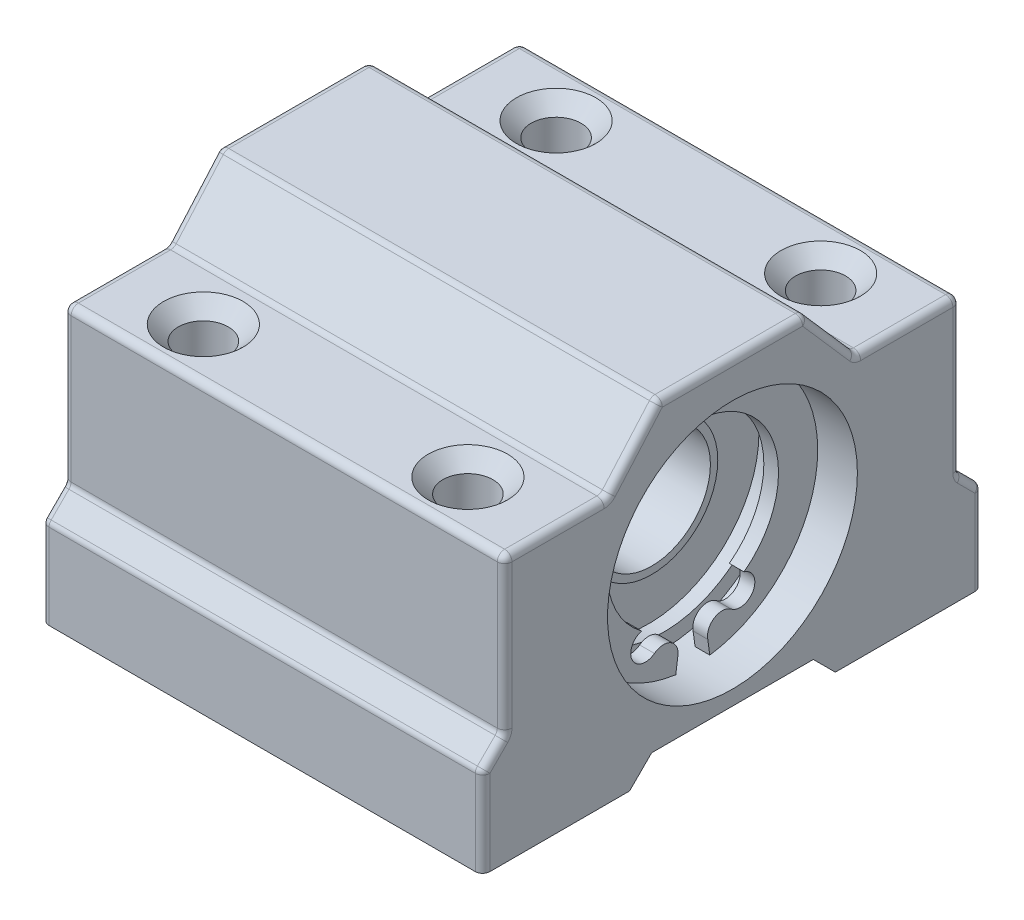
from build123d import *

# Parameters (mm, degrees)
SKETCH1_R           = 8.5
BOSS_EXTRUDE1_DEPTH = 30
EXTRUDE_THIN1_START = 0.5
SKETCH1_4_R         = 4.5
SKETCH1_4_R_2       = 4
EXTRUDE_THIN1_DEPTH = 24
BOSS_EXTRUDE2_START = 0.8
SKETCH1_5_R         = 7.5
SKETCH1_5_R_2       = 4
BOSS_EXTRUDE2_DEPTH = 23.5
BOSS_EXTRUDE3_START = 0.3
SKETCH1_6_R         = 8.5
SKETCH1_6_R_2       = 7.5
BOSS_EXTRUDE3_DEPTH = 25
BOSS_EXTRUDE4_START = 1
BOSS_EXTRUDE4_DEPTH = 1
FILLET1_R           = 0.5
SKETCH4_R           = 1.7
CUT_EXTRUDE3_DEPTH  = 41.902322746
CHAMFER1_SIZE       = 1


with BuildPart() as part:
    # Sketch1 → Boss-Extrude1 (new body)
    with BuildSketch(Plane(origin=(0, 0, 0), x_dir=(0, 0, -1), z_dir=(1, 0, 0))):
        Polygon((-17, -11), (-7, -11), (-5.5, -9.5), (5.5, -9.5), (7, -11), (17, -11), (17, -5), (15.5, -3.5), (15.5, 7), (8.5, 7), (5, 11), (-5, 11), (-8.5, 7), (-15.5, 7), (-15.5, -3.5), (-17, -5), align=None)
        Circle(SKETCH1_R, mode=Mode.SUBTRACT)
    extrude(amount=BOSS_EXTRUDE1_DEPTH)



with BuildPart() as body_2:
    # Sketch1<4> → Extrude-Thin1 (new body)
    with BuildSketch(Plane(origin=(0, 0, 0), x_dir=(0, 0, -1), z_dir=(1, 0, 0)).offset(EXTRUDE_THIN1_START)):
        Circle(SKETCH1_4_R)
        Circle(SKETCH1_4_R_2, mode=Mode.SUBTRACT)
    extrude(amount=EXTRUDE_THIN1_DEPTH)

    # Sketch1<5> → Boss-Extrude2 (add)
    with BuildSketch(Plane(origin=(0, 0, 0), x_dir=(0, 0, -1), z_dir=(1, 0, 0)).offset(BOSS_EXTRUDE2_START)):
        Circle(SKETCH1_5_R)
        Circle(SKETCH1_5_R_2, mode=Mode.SUBTRACT)
    extrude(amount=BOSS_EXTRUDE2_DEPTH)


with BuildPart() as part_1:
    add(part.part)

    add(body_2.part)  # Boss-Extrude3 merges body 2
    # Sketch1<6> → Boss-Extrude3 (add)
    with BuildSketch(Plane(origin=(0, 0, 0), x_dir=(0, 0, -1), z_dir=(1, 0, 0)).offset(BOSS_EXTRUDE3_START)):
        Circle(SKETCH1_6_R)
        Circle(SKETCH1_6_R_2, mode=Mode.SUBTRACT)
    extrude(amount=BOSS_EXTRUDE3_DEPTH)

    # Sketch3 → Boss-Extrude4 (add)
    with BuildSketch(Plane(origin=(25.3, 0, 0), x_dir=(0, 0, -1), z_dir=(1, 0, 0)).offset(BOSS_EXTRUDE4_START)):
        with BuildLine():
            Line((-1.020577541, -7.430236974), (-1.156654546, -8.420935237))
            ThreePointArc((-1.156654546, -8.420935237), (0, 8.5), (1.156654546, -8.420935237))
            Line((1.156654546, -8.420935237), (1.020577541, -7.430236974))
            ThreePointArc((1.020577541, -7.430236974), (1.470233465, -6.380272635), (2.611031056, -6.436809522))
            ThreePointArc((2.611031056, -6.436809522), (4.117409452, -6.090571441), (3.484752301, -4.680322664))
            ThreePointArc((3.484752301, -4.680322664), (0, 5.835145143), (-3.484752301, -4.680322664))
            ThreePointArc((-3.484752301, -4.680322664), (-4.117409452, -6.090571441), (-2.611031056, -6.436809522))
            ThreePointArc((-2.611031056, -6.436809522), (-1.470233465, -6.380272635), (-1.020577541, -7.430236974))
        make_face()
    extrude(amount=BOSS_EXTRUDE4_DEPTH)

    # Fillet1
    fillet1_edges = [part_1.edges().sort_by_distance(p)[0] for p in [
        (15, -3.5, -15.5),
        (15, -3.5, 15.5),
        (15, -5, 17),
        (15, -5, -17),
        (15, 7, -8.5),
        (15, 7, 8.5),
        (15, 11, 5),
        (15, 11, -5),
        (15, 7, -15.5),
        (15, 7, 15.5),
        (30, 9, -6.75),
        (30, 9, 6.75),
        (30, 1.75, 15.5),
        (0, -4.25, 16.25),
        (0, 9, 6.75),
        (30, -4.25, -16.25),
        (30, -8, -17),
        (30, 1.75, -15.5),
        (30, 11, 0),
        (30, 7, -12),
        (30, 7, 12),
        (30, -4.25, 16.25),
        (30, -8, 17),
        (0, -8, -17),
        (0, -4.25, -16.25),
        (0, 1.75, -15.5),
        (0, 9, -6.75),
        (0, 7, -12),
        (0, 11, 0),
        (0, -8, 17),
        (0, 1.75, 15.5),
        (0, 7, 12),
    ]]
    fillet(fillet1_edges, radius=FILLET1_R)

    # Sketch4 → Cut-Extrude3 (cut, through all)
    with BuildSketch(Plane.XZ.offset(11)):
        with Locations((6, 12)):
            Circle(SKETCH4_R)
        with Locations((24, 12)):
            Circle(SKETCH4_R)
        with Locations((24, -12)):
            Circle(SKETCH4_R)
        with Locations((6, -12)):
            Circle(SKETCH4_R)
    extrude(amount=-CUT_EXTRUDE3_DEPTH, mode=Mode.SUBTRACT)

    # Chamfer1
    chamfer1_edges = [part_1.edges().sort_by_distance(p)[0] for p in [
        (22.3, 7, -12),
        (4.3, 7, -12),
        (4.3, 7, 12),
        (22.3, 7, 12),
        (22.3, -11, 12),
        (4.3, -11, 12),
    ]]
    chamfer(chamfer1_edges, length=CHAMFER1_SIZE)


solid = part_1.part
